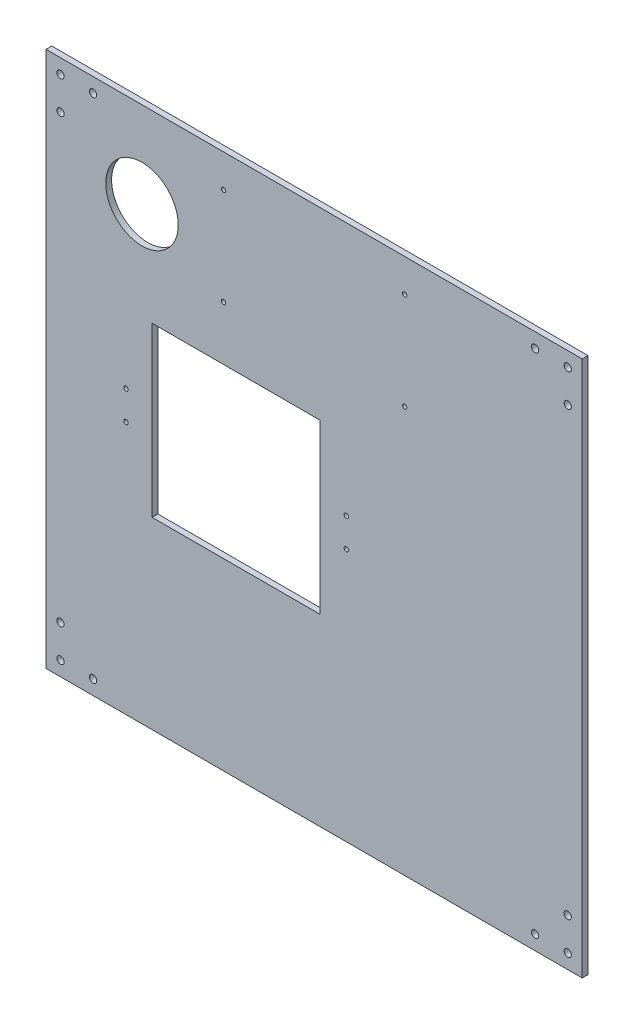
from build123d import *

# Parameters (mm, degrees)
SKETCH_1_W          = 370
SKETCH_1_H          = 370
EXTRUDE_1_DEPTH     = 4
SKETCH_2_R          = 2.5
CUT_EXTRUDE_1_DEPTH = 262.660084843
SKETCH_4_W          = 116
SKETCH_4_H          = 116
CUT_EXTRUDE_5_DEPTH = 262.660084843
SKETCH_5_R          = 1.5
CUT_EXTRUDE_6_DEPTH = 262.660084843
SKETCH_6_R          = 1.5
CUT_EXTRUDE_7_DEPTH = 262.660084843
SKETCH_7_R          = 25
CUT_EXTRUDE_8_DEPTH = 262.660084843


with BuildPart() as part:
    # 草图1 → 凸台-拉伸1 (new body)
    with BuildSketch(Plane.XY):
        Rectangle(SKETCH_1_W, SKETCH_1_H)
    extrude(amount=EXTRUDE_1_DEPTH)

    # 草图2 → 切除-拉伸1 (cut, through all)
    with BuildSketch(Plane.XY.offset(4)):
        with Locations((-175, -175)):
            Circle(SKETCH_2_R)
        with Locations((-152.5, -175)):
            Circle(SKETCH_2_R)
        with Locations((-175, -152.5)):
            Circle(SKETCH_2_R)
        with Locations((-152.5, 175)):
            Circle(SKETCH_2_R)
        with Locations((-175, 152.5)):
            Circle(SKETCH_2_R)
        with Locations((-175, 175)):
            Circle(SKETCH_2_R)
        with Locations((175, 152.5)):
            Circle(SKETCH_2_R)
        with Locations((152.5, 175)):
            Circle(SKETCH_2_R)
        with Locations((175, 175)):
            Circle(SKETCH_2_R)
        with Locations((152.5, -175)):
            Circle(SKETCH_2_R)
        with Locations((175, -152.5)):
            Circle(SKETCH_2_R)
        with Locations((175, -175)):
            Circle(SKETCH_2_R)
    extrude(amount=-CUT_EXTRUDE_1_DEPTH, mode=Mode.SUBTRACT)

    # 草图4 → 切除-拉伸5 (cut, through all)
    with BuildSketch(Plane(origin=(0, 0, 0), x_dir=(-1, 0, 0), z_dir=(0, 0, -1))):
        with Locations((53.772876186, -0.09)):
            Rectangle(SKETCH_4_W, SKETCH_4_H)
    extrude(amount=-CUT_EXTRUDE_5_DEPTH, mode=Mode.SUBTRACT)

    # 草图5 → 切除-拉伸6 (cut, through all)
    with BuildSketch(Plane(origin=(0, 0, 0), x_dir=(-1, 0, 0), z_dir=(0, 0, -1))):
        with Locations((-22.227123814, -10.09)):
            Circle(SKETCH_5_R)
        with Locations((-22.227123814, 9.91)):
            Circle(SKETCH_5_R)
        with Locations((129.772876186, 9.91)):
            Circle(SKETCH_5_R)
        with Locations((129.772876186, -10.09)):
            Circle(SKETCH_5_R)
    extrude(amount=-CUT_EXTRUDE_6_DEPTH, mode=Mode.SUBTRACT)

    # 草图6 → 切除-拉伸7 (cut, through all)
    with BuildSketch(Plane(origin=(0, 0, 0), x_dir=(-1, 0, 0), z_dir=(0, 0, -1))):
        with Locations((-62.5, 162.249795252)):
            Circle(SKETCH_6_R)
        with Locations((-62.5, 95.249795252)):
            Circle(SKETCH_6_R)
        with Locations((62.5, 95.249795252)):
            Circle(SKETCH_6_R)
        with Locations((62.5, 162.249795252)):
            Circle(SKETCH_6_R)
    extrude(amount=-CUT_EXTRUDE_7_DEPTH, mode=Mode.SUBTRACT)

    # 草图7 → 切除-拉伸8 (cut, through all)
    with BuildSketch(Plane(origin=(0, 0, 0), x_dir=(-1, 0, 0), z_dir=(0, 0, -1))):
        with Locations((118.769854949, 125.631801741)):
            Circle(SKETCH_7_R)
    extrude(amount=-CUT_EXTRUDE_8_DEPTH, mode=Mode.SUBTRACT)


solid = part.part
